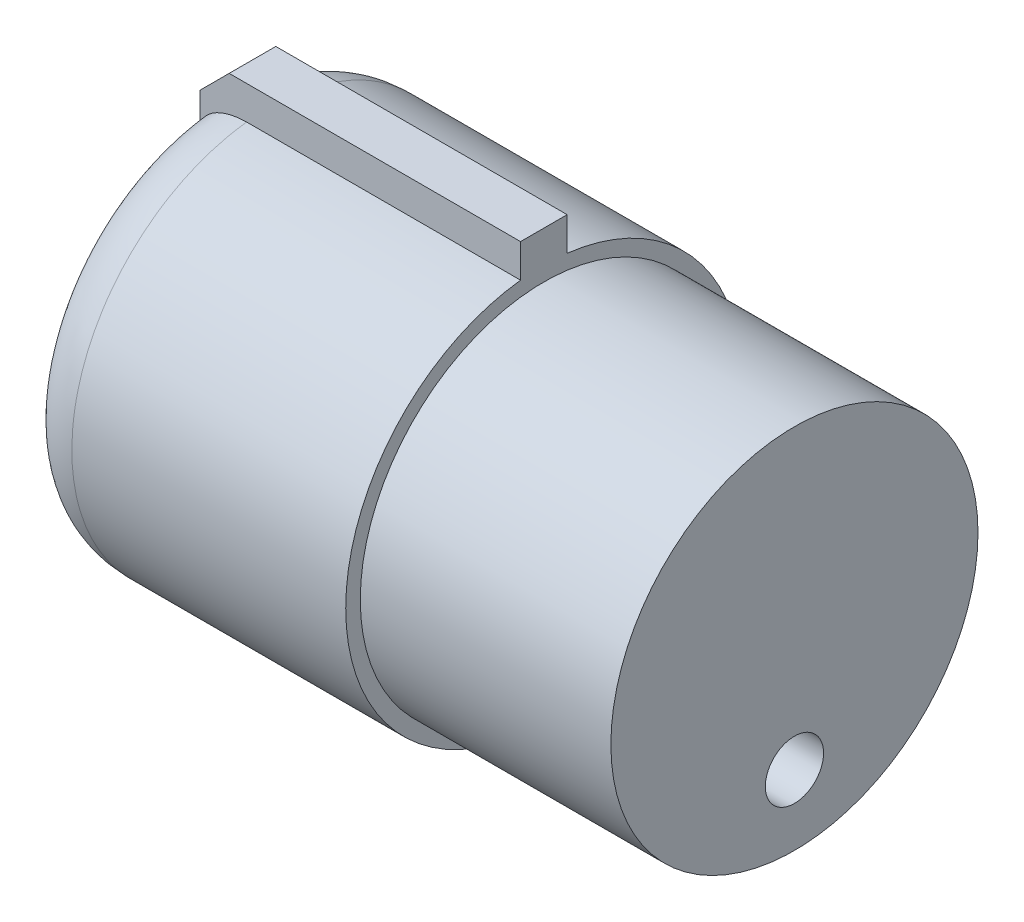
from build123d import *

# Parameters (mm, degrees)
SKETCH2_W           = 0.8
SKETCH2_H           = 1
BOSS_EXTRUDE1_DEPTH = 5.5
CHAMFER1_SIZE       = 0.5
FILLET1_SIZE        = 0.5
FILLET1_SIZE_2      = 0.8
SKETCH3_R           = 0.5
CUT_EXTRUDE1_DEPTH  = 10


with BuildPart() as part:
    # Sketch1 → Revolve1 (revolve)
    with BuildSketch(Plane.XY, mode=Mode.PRIVATE) as revolve1_sk:
        Polygon((8.8, 0), (8.8, 2.5), (4.85, 2.5), (4.85, 2.75), (0, 2.75), (0, 3.4), (5.5, 3.4), (5.5, 3.15), (9.8, 3.15), (9.8, 0), align=None)
    revolve(revolve1_sk.sketch.rotate(Axis((0, 0, 0), (1, 0, 0)), 90), axis=Axis((0, 0, 0), (1, 0, 0)))

    # Sketch2 → Boss-Extrude1 (add)
    with BuildSketch(Plane.ZY):
        with Locations((0, 3.45)):
            Rectangle(SKETCH2_W, SKETCH2_H)
        with Locations((0, -3.45)):
            Rectangle(SKETCH2_W, SKETCH2_H)
    extrude(amount=-BOSS_EXTRUDE1_DEPTH)

    # Chamfer1
    chamfer1_edges = [part.edges().sort_by_distance(p)[0] for p in [
        (0, 3.95, 0),
        (0, -3.95, 0),
    ]]
    chamfer(chamfer1_edges, length=CHAMFER1_SIZE)

    # Fillet1
    # an asymmetric fillet: 0.8, 0.5 mm, written as the material it takes off along each edge
    with BuildSketch(Plane(origin=(0, 0, 0), x_dir=(0, -0.8910585432976912, -0.45388839202627373), z_dir=(0, 0.45388839202627373, -0.8910585432976912))) as fillet1_piece_1_section:
        with BuildLine():
            Bezier((3.4 - FILLET1_SIZE, 0), (3.4, 0), (3.4, -FILLET1_SIZE_2), weights=[1, 0.707106781, 1])
            Line((3.4, -FILLET1_SIZE_2), (3.4, 0))
            Line((3.4, 0), (3.4 - FILLET1_SIZE, 0))
        make_face()
    fillet1_piece_1 = revolve(axis=Axis((0, 0, 0), (-1, 0, 0)), revolution_arc=233.986868401, mode=Mode.PRIVATE)
    fillet1_piece_1 = split(fillet1_piece_1, bisect_by=Plane(origin=(0.182093779, -3.13232652, -0.4), z_dir=(0, 0, -1)), keep=Keep.TOP, mode=Mode.PRIVATE)
    add(fillet1_piece_1, mode=Mode.SUBTRACT)
    with BuildSketch(Plane(origin=(0, 0, 0), x_dir=(0, -0.8910585432976912, -0.45388839202627373), z_dir=(0, 0.45388839202627373, -0.8910585432976912))) as fillet1_piece_2_section:
        with BuildLine():
            Bezier((3.4 - FILLET1_SIZE, 0), (3.4, 0), (3.4, -FILLET1_SIZE_2), weights=[1, 0.707106781, 1])
            Line((3.4, -FILLET1_SIZE_2), (3.4, 0))
            Line((3.4, 0), (3.4 - FILLET1_SIZE, 0))
        make_face()
    fillet1_piece_2 = revolve(axis=Axis((0, 0, 0), (-1, 0, 0)), revolution_arc=233.986868401, mode=Mode.PRIVATE)
    fillet1_piece_2 = split(fillet1_piece_2, bisect_by=Plane(origin=(0.229357983, 0, 0.4), z_dir=(0, 0, 1)), keep=Keep.TOP, mode=Mode.PRIVATE)
    add(fillet1_piece_2, mode=Mode.SUBTRACT)
    with BuildSketch(Plane(origin=(0, 0, 0), x_dir=(0, -0.8910585432977036, 0.4538883920262497), z_dir=(0, 0.4538883920262497, 0.8910585432977036))) as fillet1_piece_3_section:
        with BuildLine():
            Bezier((3.4 - FILLET1_SIZE, 0), (3.4, 0), (3.4, FILLET1_SIZE_2), weights=[1, 0.707106781, 1])
            Line((3.4, FILLET1_SIZE_2), (3.4, 0))
            Line((3.4, 0), (3.4 - FILLET1_SIZE, 0))
        make_face()
    fillet1_piece_3 = revolve(axis=Axis((0, 0, 0), (1, 0, 0)), revolution_arc=233.986868401, mode=Mode.PRIVATE)
    fillet1_piece_3 = split(fillet1_piece_3, bisect_by=Plane(origin=(0.18209405, -3.132326501, 0.4), z_dir=(0, 0, 1)), keep=Keep.TOP, mode=Mode.PRIVATE)
    add(fillet1_piece_3, mode=Mode.SUBTRACT)
    with BuildSketch(Plane(origin=(0, 0, 0), x_dir=(0, -0.8910585432977036, 0.4538883920262497), z_dir=(0, 0.4538883920262497, 0.8910585432977036))) as fillet1_piece_4_section:
        with BuildLine():
            Bezier((3.4 - FILLET1_SIZE, 0), (3.4, 0), (3.4, FILLET1_SIZE_2), weights=[1, 0.707106781, 1])
            Line((3.4, FILLET1_SIZE_2), (3.4, 0))
            Line((3.4, 0), (3.4 - FILLET1_SIZE, 0))
        make_face()
    fillet1_piece_4 = revolve(axis=Axis((0, 0, 0), (1, 0, 0)), revolution_arc=233.986868401, mode=Mode.PRIVATE)
    fillet1_piece_4 = split(fillet1_piece_4, bisect_by=Plane(origin=(0.229357983, 0, -0.4), z_dir=(0, 0, -1)), keep=Keep.TOP, mode=Mode.PRIVATE)
    add(fillet1_piece_4, mode=Mode.SUBTRACT)

    # Sketch3 → Cut-Extrude1 (cut)
    with BuildSketch(Plane(origin=(9.8, 0, 0), x_dir=(0, 0, -1), z_dir=(1, 0, 0))):
        with Locations((0, -1.95)):
            Circle(SKETCH3_R)
    extrude(amount=-CUT_EXTRUDE1_DEPTH, mode=Mode.SUBTRACT)


solid = part.part
